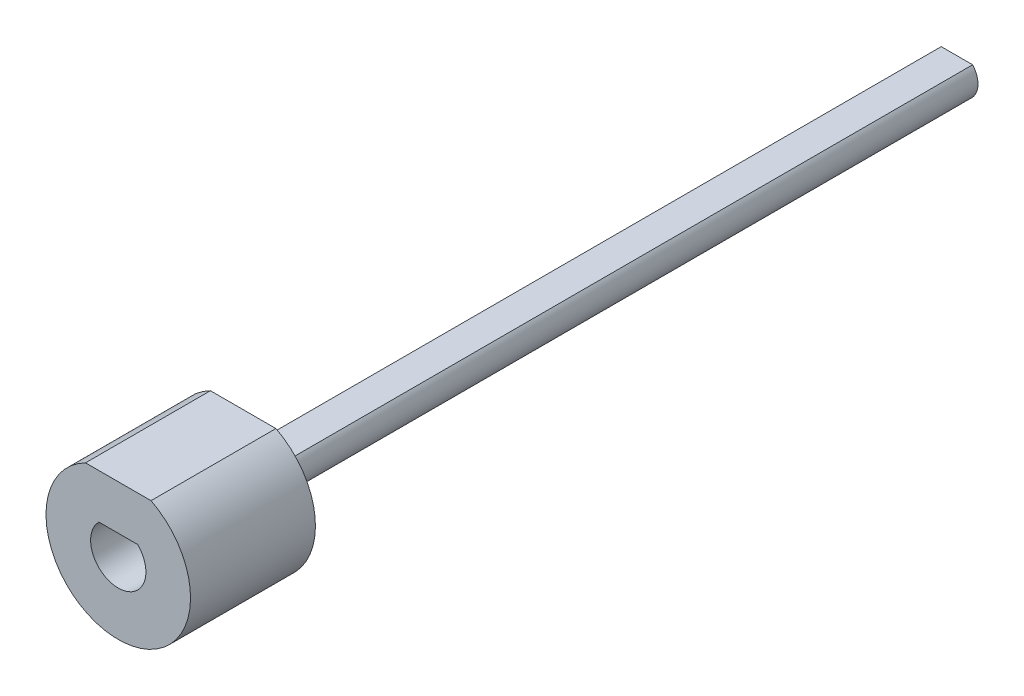
from build123d import *

# Parameters (mm, degrees)
BOSS_EXTRUDE1_DEPTH = 6.35
BOSS_EXTRUDE2_START = 2.54
BOSS_EXTRUDE2_DEPTH = 2.54
BOSS_EXTRUDE3_DEPTH = 50.8


with BuildPart() as part:
    # Sketch1 → Boss-Extrude1 (new body)
    with BuildSketch(Plane.XY):
        with BuildLine():
            Line((-2.331548447, 4.5847), (2.331548447, 4.5847))
            ThreePointArc((2.331548447, 4.5847), (0, -5.1435), (-2.331548447, 4.5847))
        make_face()
        with BuildLine():
            Line((-1.373949839, 1.4097), (1.373949839, 1.4097))
            ThreePointArc((1.373949839, 1.4097), (0, -1.9685), (-1.373949839, 1.4097))
        make_face(mode=Mode.SUBTRACT)
    extrude(amount=BOSS_EXTRUDE1_DEPTH)

    # Sketch3 → Boss-Extrude2 (add)
    with BuildSketch(Plane(origin=(0, 0, 0), x_dir=(-1, 0, 0), z_dir=(0, 0, -1)).offset(BOSS_EXTRUDE2_START)):
        with BuildLine():
            Line((-2.331548447, 4.5847), (2.331548447, 4.5847))
            ThreePointArc((2.331548447, 4.5847), (0, -5.1435), (-2.331548447, 4.5847))
        make_face()
    extrude(amount=-BOSS_EXTRUDE2_DEPTH)

    # Sketch2 → Boss-Extrude3 (add)
    with BuildSketch(Plane(origin=(0, 0, -2.54), x_dir=(-1, 0, 0), z_dir=(0, 0, -1))):
        with BuildLine():
            Line((1.118033989, 1), (-1.118033989, 1))
            ThreePointArc((-1.118033989, 1), (0, -1.5), (1.118033989, 1))
        make_face()
    extrude(amount=BOSS_EXTRUDE3_DEPTH)


solid = part.part
